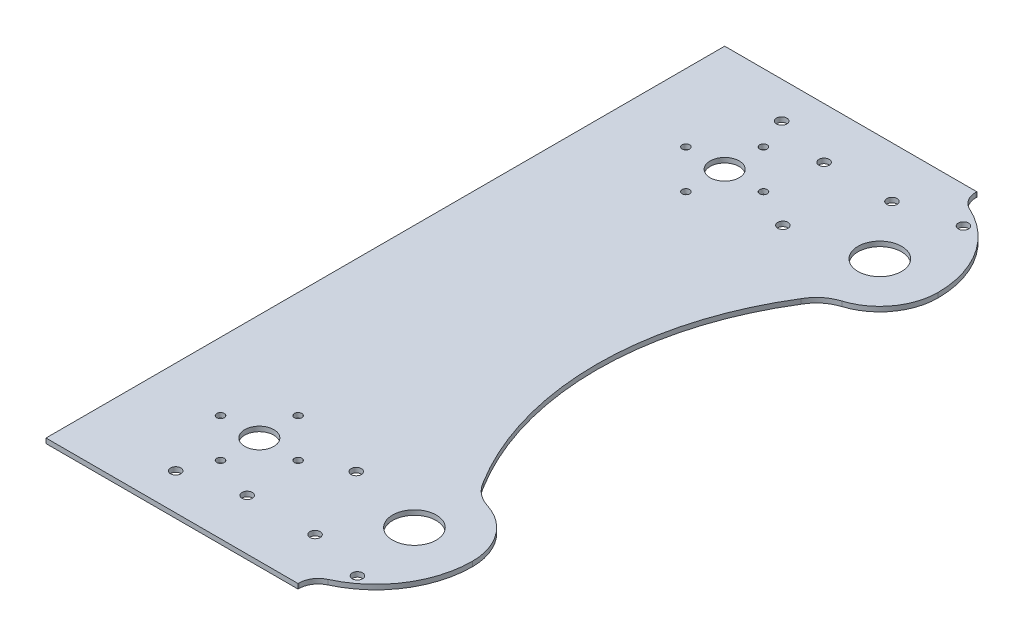
from build123d import *

# Parameters (mm, degrees)
SKETCH1_W                    = 165.1
SKETCH1_H                    = 444.5
BOSS_EXTRUDE1_DEPTH          = 3.175
CUT_EXTRUDE2_DEPTH           = 238.106823236
F_10_0_1935_DIAMETER_HOLE1_D = 4.9149
BOSS_EXTRUDE2_DEPTH          = 3.175
FILLET1_R                    = 12.7
SKETCH7_R                    = 14.2875
CUT_EXTRUDE3_DEPTH           = 256.996373265
CUT_EXTRUDE4_DEPTH           = 256.996373265
SKETCH10_R                   = 3.3782
CUT_EXTRUDE5_DEPTH           = 256.996373265


with BuildPart() as part:
    # Sketch1 → Boss-Extrude1 (new body)
    with BuildSketch(Plane(origin=(0, 0, 0), x_dir=(1, 0, 0), z_dir=(0, 1, 0))):
        Rectangle(SKETCH1_W, SKETCH1_H)
    extrude(amount=BOSS_EXTRUDE1_DEPTH)

    # Sketch3 → Cut-Extrude2 (cut, through all)
    with BuildSketch(Plane(origin=(0, 3.175, 0), x_dir=(1, 0, 0), z_dir=(0, 1, 0))):
        with BuildLine():
            ThreePointArc((-3.175, -152.4), (-12.7, -142.875), (-22.225, -152.4))
            ThreePointArc((-22.225, -152.4), (-12.7, -161.925), (-3.175, -152.4))
        make_face()
        with BuildLine():
            ThreePointArc((-3.175, 152.4), (-12.7, 161.925), (-22.225, 152.4))
            ThreePointArc((-22.225, 152.4), (-12.7, 142.875), (-3.175, 152.4))
        make_face()
    extrude(amount=-CUT_EXTRUDE2_DEPTH, mode=Mode.SUBTRACT)

    # #10 (0.1935) Diameter Hole1 (through all)
    with Locations(Plane(origin=(0, 3.175, 0), x_dir=(1, 0, 0), z_dir=(0, 1, 0))):
        with Locations((-12.7, -177.8), (-38.1, -152.4), (-12.7, -127), (12.7, -152.4), (-12.7, 177.8), (-38.1, 152.4), (-12.7, 127), (12.7, 152.4)):
            Hole(F_10_0_1935_DIAMETER_HOLE1_D / 2)

    # Sketch9 → Boss-Extrude2 (add)
    with BuildSketch(Plane(origin=(0, 0, 0), x_dir=(1, 0, 0), z_dir=(0, 1, 0))):
        with BuildLine():
            Line((82.55, 222.25), (82.55, 212.97513929))
            ThreePointArc((82.55, 212.97513929), (114.695336702, 189.967106623), (127, 152.4))
            ThreePointArc((127, 152.4), (119.617202021, 129.859736026), (100.33, 116.054916426))
            ThreePointArc((100.33, 116.054916426), (87.471865319, 106.851703359), (82.55, 91.82486071))
            Line((82.55, 91.82486071), (82.55, 82.55))
            Line((82.55, 82.55), (80.9625, 82.55))
            Line((80.9625, 82.55), (80.9625, 222.25))
            Line((80.9625, 222.25), (82.55, 222.25))
        make_face()
        with BuildLine():
            Line((80.9625, -222.25), (80.9625, -82.55))
            Line((80.9625, -82.55), (82.55, -82.55))
            Line((82.55, -82.55), (82.55, -91.82486071))
            ThreePointArc((82.55, -91.82486071), (87.471865319, -106.851703359), (100.33, -116.054916426))
            ThreePointArc((100.33, -116.054916426), (119.617202021, -129.859736026), (127, -152.4))
            ThreePointArc((127, -152.4), (114.695336702, -189.967106623), (82.55, -212.97513929))
            Line((82.55, -212.97513929), (82.55, -222.25))
            Line((82.55, -222.25), (80.9625, -222.25))
        make_face()
    extrude(amount=BOSS_EXTRUDE2_DEPTH)

    # Fillet1
    fillet1_edges = [part.edges().sort_by_distance(p)[0] for p in [
        (82.55, 1.5875, 212.97513929),
        (82.55, 1.5875, -212.97513929),
    ]]
    fillet(fillet1_edges, radius=FILLET1_R)

    # Sketch7 → Cut-Extrude3 (cut, through all)
    with BuildSketch(Plane(origin=(0, 3.175, 0), x_dir=(1, 0, 0), z_dir=(0, 1, 0))):
        with Locations((88.9, -152.4)):
            Circle(SKETCH7_R)
        with Locations((88.9, 152.4)):
            Circle(SKETCH7_R)
    extrude(amount=-CUT_EXTRUDE3_DEPTH, mode=Mode.SUBTRACT)

    # Sketch8 → Cut-Extrude4 (cut, through all)
    with BuildSketch(Plane(origin=(0, 3.175, 0), x_dir=(1, 0, 0), z_dir=(0, 1, 0))):
        with BuildLine():
            Line((87.471865319, 106.851703359), (87.471865319, -106.851703359))
            ThreePointArc((87.471865319, -106.851703359), (55.947713236, 0), (87.471865319, 106.851703359))
        make_face()
    extrude(amount=-CUT_EXTRUDE4_DEPTH, mode=Mode.SUBTRACT)

    # Sketch10 → Cut-Extrude5 (cut, through all)
    with BuildSketch(Plane(origin=(0, 3.175, 0), x_dir=(1, 0, 0), z_dir=(0, 1, 0))):
        with Locations((38.1, -139.7)):
            Circle(SKETCH10_R)
        with Locations((-21.43125, -198.4375)):
            Circle(SKETCH10_R)
        with Locations((15.875, -188.9125)):
            Circle(SKETCH10_R)
        with Locations((60.325, -188.9125)):
            Circle(SKETCH10_R)
        with Locations((97.63125, -198.4375)):
            Circle(SKETCH10_R)
        with Locations((97.63125, 198.4375)):
            Circle(SKETCH10_R)
        with Locations((60.325, 188.9125)):
            Circle(SKETCH10_R)
        with Locations((15.875, 188.9125)):
            Circle(SKETCH10_R)
        with Locations((38.1, 139.7)):
            Circle(SKETCH10_R)
        with Locations((-21.43125, 198.4375)):
            Circle(SKETCH10_R)
    extrude(amount=-CUT_EXTRUDE5_DEPTH, mode=Mode.SUBTRACT)


solid = part.part
